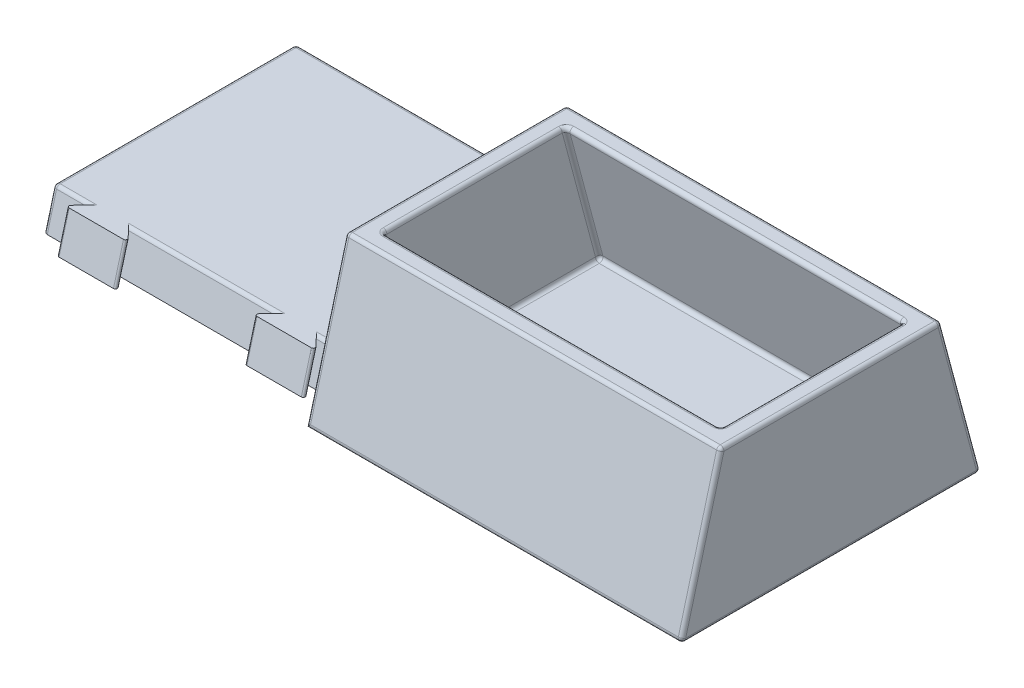
from build123d import *

# Parameters (mm, degrees)
EXTRUDE_2_DEPTH     = 180
CUT_EXTRUDE_1_DEPTH = 80.1
CUT_EXTRUDE_2_REACH = 202.998
SHELL_START         = 85.1
SHELL_1_DEPTH       = 89.9
FILLET_1_R          = 1
FILLET_2_R          = 0.5


# Read off the part's stored shape, not the designer's step: 抽壳1
with BuildPart() as part:
    # 草图3 → 凸台-拉伸2 (new body)
    with BuildSketch(Plane(origin=(0, 0, 0), x_dir=(0, 0, -1), z_dir=(1, 0, 0))):
        Polygon((0, 0), (10.717967697, 40), (69.282032303, 40), (80, 0), align=None)
    extrude(amount=EXTRUDE_2_DEPTH)

    # 草图4 → 切除-拉伸1 (cut)
    with BuildSketch(Plane.ZY):
        Polygon((-77.320508076, 10), (-2.679491924, 10), (-10.717967697, 40), (-69.282032303, 40), align=None)
    extrude(amount=-CUT_EXTRUDE_1_DEPTH, mode=Mode.SUBTRACT)

    # 切除-拉伸2: up to this plane
    cut_extrude_2_end = Plane(origin=(80.1, 10, -77.320508076), z_dir=(0, -1, 0))
    # 草图6 → 切除-拉伸2 (cut, up to the surface)
    with BuildSketch(Plane(origin=(0, 0, 0), x_dir=(-1, 0, 0), z_dir=(0, 0.9659258262890672, -0.2588190451025246)), mode=Mode.PRIVATE) as cut_extrude_2_sk1:
        Polygon((-19.95, -10), (-60.05, -10), (-56.55, -6.5), (-73.45, -6.5), (-69.95, -10), (-80.1, -10), (-80.1, 0), (0, 0), (0, -10), (-10.05, -10), (-6.55, -6.5), (-23.45, -6.5), align=None)
    cut_extrude_2_tool1 = split(extrude(cut_extrude_2_sk1.sketch, amount=CUT_EXTRUDE_2_REACH, mode=Mode.PRIVATE), bisect_by=cut_extrude_2_end, keep=Keep.BOTH, mode=Mode.PRIVATE)
    add(cut_extrude_2_tool1.solids().sort_by_distance((40.056632, -1.187758, -4.432771))[0], mode=Mode.SUBTRACT)

    # 抽壳1 outline → 抽壳1 (cut)
    with BuildSketch(Plane.YZ.offset(SHELL_START)):
        Polygon((5, -6.516126864), (5, -73.483873136), (40, -64.105651401), (40, -15.894348599), align=None)
    extrude(amount=SHELL_1_DEPTH, mode=Mode.SUBTRACT)

    # 圆角1
    fillet_1_edges = [part.edges().sort_by_distance(p)[0] for p in [
        (180, 40, -40),
        (180, 20, -5.358983849),
        (80.1, 25, -73.301270189),
        (40.05, 10, -77.320508076),
        (80.1, 40, -40),
        (80.1, 20, -5.358983849),
        (0, 10, -45.176380902),
        (0, 0, -45.176380902),
        (40, 10, -13.032253728),
        (75.025, 10, -13.032253728),
        (0, 5, -11.692507766),
        (5.025, 10, -13.032253728),
        (180, 0, -40),
        (0, 5, -78.660254038),
        (130.05, 0, 0),
        (130.05, 5, -6.516126864),
        (130.05, 40, -15.894348599),
        (130.05, 40, -64.105651401),
        (130.05, 5, -73.483873136),
        (175, 5, -40),
        (130.05, 40, -10.717967697),
        (175, 22.5, -68.794762268),
        (175, 40, -40),
        (175, 22.5, -11.205237732),
        (85.1, 22.5, -68.794762268),
        (85.1, 5, -40),
        (85.1, 22.5, -11.205237732),
        (85.1, 40, -40),
        (130.05, 40, -69.282032303),
        (90, 0, -80),
        (180, 20, -74.641016151),
    ]]
    fillet(fillet_1_edges, radius=FILLET_1_R)

    # 圆角2
    fillet_2_edges = [part.edges().sort_by_distance(p)[0] for p in [
        (56.55, 5, -8.069041135),
        (73.45, 5, -8.069041135),
        (6.55, 5, -8.069041135),
        (23.45, 5, -8.069041135),
    ]]
    fillet(fillet_2_edges, radius=FILLET_2_R)


solid = part.part
